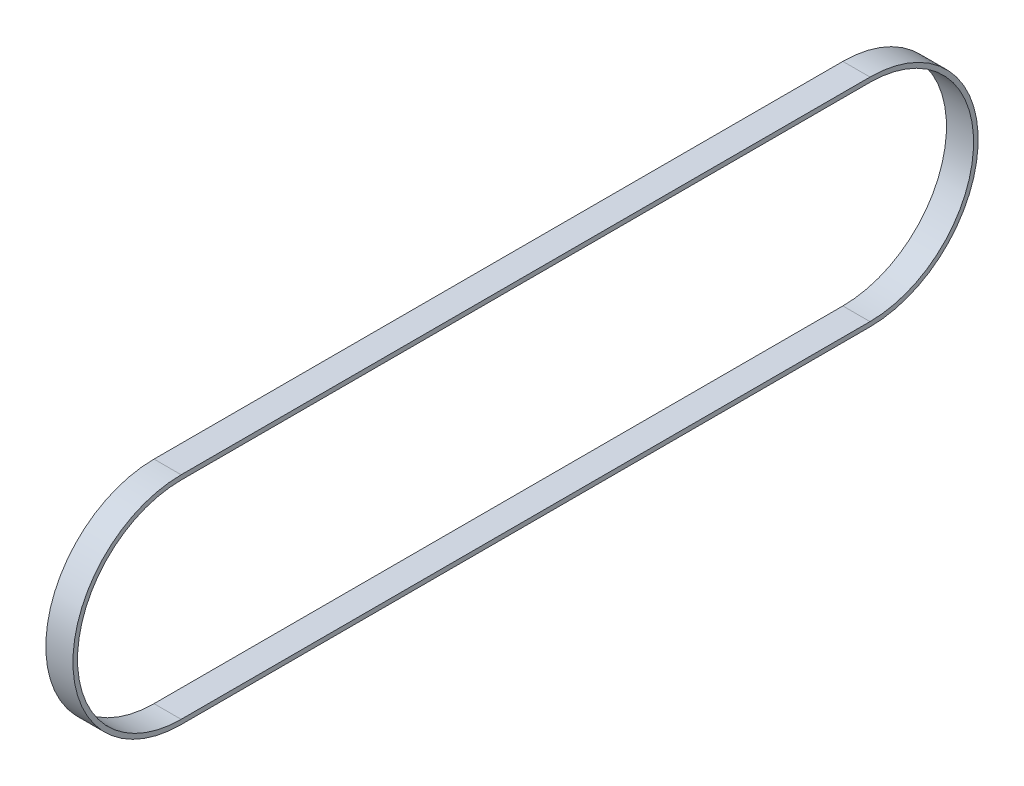
from build123d import *

# Parameters (mm, degrees)
BOSS_EXTRUDE1_DEPTH = 15


with BuildPart() as part:
    # Sketch1 → Boss-Extrude1 (new body)
    with BuildSketch(Plane(origin=(0, 0, 0), x_dir=(0, 0, -1), z_dir=(1, 0, 0))):
        with BuildLine():
            Line((0, 59.8424), (381, 59.8424))
            ThreePointArc((381, 59.8424), (440.8424, 0), (381, -59.8424))
            Line((381, -59.8424), (0, -59.8424))
            ThreePointArc((0, -59.8424), (-59.8424, 0), (0, 59.8424))
        make_face()
        with BuildLine():
            Line((0, 57.3024), (381, 57.3024))
            ThreePointArc((381, 57.3024), (438.3024, 0), (381, -57.3024))
            Line((381, -57.3024), (0, -57.3024))
            ThreePointArc((0, -57.3024), (-57.3024, 0), (0, 57.3024))
        make_face(mode=Mode.SUBTRACT)
    extrude(amount=BOSS_EXTRUDE1_DEPTH)


solid = part.part
